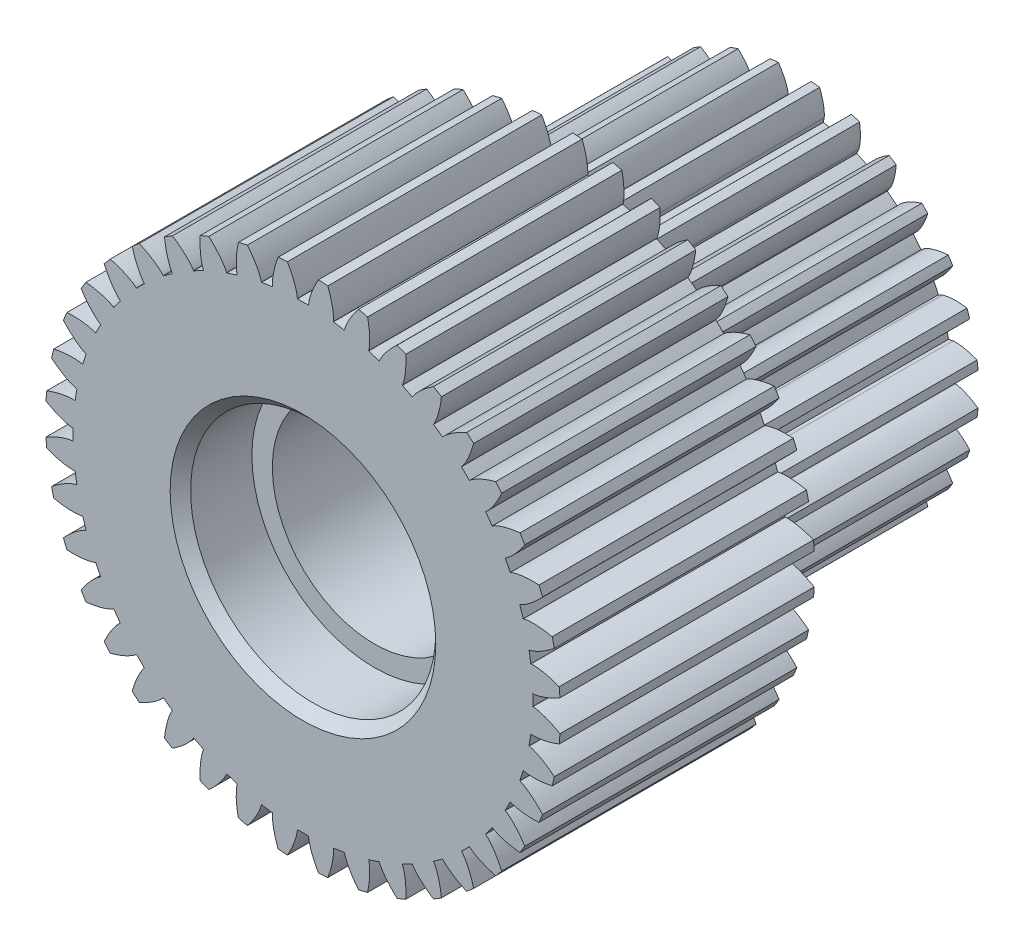
from build123d import *

# Parameters (mm, degrees)
SKETCH1_R           = 12.6
BOSS_EXTRUDE1_DEPTH = 6.222982735
CUT_EXTRUDE1_DEPTH  = 19.874467254
CIRPATTERN2_COUNT   = 40
SKETCH4_R           = 9
BOSS_EXTRUDE2_DEPTH = 11.62950298
CUT_EXTRUDE2_START  = -11.62950298
CUT_EXTRUDE2_DEPTH  = 11.62950298
CIRPATTERN3_COUNT   = 28
SKETCH3_R           = 5
CUT_EXTRUDE3_DEPTH  = 30.93309561
SKETCH7_R           = 6
CUT_EXTRUDE4_DEPTH  = 3.5
CHAMFER1_SIZE       = 0.5


with BuildPart() as part:
    # Sketch1 → Boss-Extrude1 (new, symmetric)
    with BuildSketch(Plane.XY):
        with Locations(Location((0, 0, 0), (0, 0, 180))):
            Circle(SKETCH1_R)
    extrude(amount=BOSS_EXTRUDE1_DEPTH, both=True)

    # Sketch2 → Cut-Extrude1 (cut, symmetric)
    with BuildSketch(Plane.XY):
        with BuildLine():
            Line((11.246660722, -0.274085027), (11.270510441, -0.274666253))
            add(Edge.make_bspline(
                [(11.270510441, -0.274666253), (11.274362796, -0.274815612), (11.285160796, -0.275406154), (11.305543882, -0.277200206), (11.338736538, -0.28108866), (11.3809122, -0.287453899), (11.435256469, -0.297297397), (11.499026137, -0.31096732), (11.568805837, -0.328156818), (11.644355714, -0.349188228), (11.719370108, -0.372223949), (11.793837153, -0.397107382), (11.867670292, -0.4236082), (11.95666212, -0.457724), (12.062733834, -0.501427934), (12.185699673, -0.556556039), (12.323897053, -0.623832925), (12.440159402, -0.685228824), (12.51999569, -0.729564843), (12.565479539, -0.755617713), (12.576923935, -0.762223288)],
                knots=[0, 0, 0, 0, 0, 0.005376749, 0.015083688, 0.02853182, 0.04661014, 0.064854849, 0.092110525, 0.119476176, 0.146842496, 0.174208854, 0.201574956, 0.228941013, 0.256307345, 0.307035032, 0.361767352, 0.416499661, 0.471231937, 0.489657345, 0.489657345, 0.489657345, 0.489657345, 0.489657345], degree=4))
            ThreePointArc((12.576923935, -0.762223288), (12.594229662, -0.381286259), (12.6, 0))
            ThreePointArc((12.6, 0), (12.594249502, 0.380630371), (12.577003257, 0.760913312))
            add(Edge.make_bspline(
                [(11.272964362, 0.274726056), (11.276816717, 0.274875415), (11.287614717, 0.275465957), (11.307997803, 0.277260009), (11.34119046, 0.281148463), (11.383366122, 0.287513702), (11.437710391, 0.2973572), (11.501480059, 0.311027123), (11.571259759, 0.328216621), (11.646809635, 0.349248031), (11.721824029, 0.372283752), (11.796291074, 0.397167184), (11.870124213, 0.423668003), (11.959116041, 0.457783803), (12.065187755, 0.501487737), (12.188153595, 0.556615842), (12.326350974, 0.623892728), (12.442004899, 0.68496733), (12.521256317, 0.72896209), (12.566150821, 0.754656839), (12.577003257, 0.760913312)],
                knots=[0, 0, 0, 0, 0, 0.005376749, 0.015083688, 0.02853182, 0.04661014, 0.064854849, 0.092110525, 0.119476176, 0.146842496, 0.174208854, 0.201574956, 0.228941013, 0.256307345, 0.307035032, 0.361767352, 0.416499661, 0.471231937, 0.488701644, 0.488701644, 0.488701644, 0.488701644, 0.488701644], degree=4))
            Line((11.272964362, 0.274726056), (11.246660722, 0.274085027))
            ThreePointArc((11.246660722, 0.274085027), (11.24916515, 0.137052684), (11.25, 0))
            ThreePointArc((11.25, 0), (11.24916515, -0.137052684), (11.246660722, -0.274085027))
        make_face()
    cut_extrude1 = extrude(amount=CUT_EXTRUDE1_DEPTH, both=True, mode=Mode.SUBTRACT)

    # CirPattern2: Cut-Extrude1 ×40 about axis
    cirpattern2_axis = Axis((0, 0, 6.222982735), (0, 0, -1))
    for i in range(1, CIRPATTERN2_COUNT):
        add(cut_extrude1.rotate(cirpattern2_axis, i * 360 / CIRPATTERN2_COUNT), mode=Mode.SUBTRACT)

    # Sketch4 → Boss-Extrude2 (add)
    with BuildSketch(Plane(origin=(0, 0, -6.222982735), x_dir=(-1, 0, 0), z_dir=(0, 0, -1))):
        with Locations(Location((0, 0, 0), (0, 0, 180))):
            Circle(SKETCH4_R)
    extrude(amount=BOSS_EXTRUDE2_DEPTH)

    # Sketch5 → Cut-Extrude2 (cut)
    with BuildSketch(Plane(origin=(0, 0, -17.852485715), x_dir=(-1, 0, 0), z_dir=(0, 0, -1)).offset(CUT_EXTRUDE2_START)):
        with BuildLine():
            add(Edge.make_bspline(
                [(7.864908633, 0.324182132), (7.867603141, 0.324332051), (7.875153713, 0.324872576), (7.898424632, 0.327316112), (7.944138999, 0.334311492), (8.000221168, 0.346060678), (8.064274923, 0.362529898), (8.125685364, 0.38074418), (8.177916633, 0.397750601), (8.229743045, 0.41604379), (8.281106732, 0.435461521), (8.342990291, 0.46038756), (8.416715125, 0.49222555), (8.50212959, 0.532258347), (8.598061506, 0.580973521), (8.694744064, 0.6341295), (8.788958417, 0.689306741), (8.868814402, 0.739411756), (8.923308451, 0.774953063), (8.955124139, 0.796315675), (8.964156804, 0.802429305)],
                knots=[0, 0, 0, 0, 0, 0.005376749, 0.015083688, 0.04661014, 0.092110525, 0.119476176, 0.146842496, 0.174208854, 0.201574956, 0.228941013, 0.256307345, 0.307035032, 0.361767352, 0.416499661, 0.471231937, 0.525964282, 0.580696616, 0.602381261, 0.602381261, 0.602381261, 0.602381261, 0.602381261], degree=4))
            Line((7.864908633, 0.324182132), (7.643509633, 0.31505633))
            ThreePointArc((7.643509633, 0.31505633), (7.648377236, 0.157561588), (7.65, 0))
            ThreePointArc((7.65, 0), (7.648377236, -0.157561588), (7.643509633, -0.31505633))
            Line((7.643509633, -0.31505633), (7.864908633, -0.324182132))
            add(Edge.make_bspline(
                [(7.864908633, -0.324182132), (7.867603141, -0.324332051), (7.875153713, -0.324872576), (7.898424632, -0.327316112), (7.944138999, -0.334311492), (8.000221168, -0.346060678), (8.064274923, -0.362529898), (8.125685364, -0.38074418), (8.177916633, -0.397750601), (8.229743045, -0.41604379), (8.281106732, -0.435461521), (8.342990291, -0.46038756), (8.416715125, -0.49222555), (8.50212959, -0.532258347), (8.598061506, -0.580973521), (8.694744064, -0.6341295), (8.788958417, -0.689306741), (8.868814402, -0.739411756), (8.923308451, -0.774953063), (8.955124139, -0.796315675), (8.964156804, -0.802429305)],
                knots=[0, 0, 0, 0, 0, 0.005376749, 0.015083688, 0.04661014, 0.092110525, 0.119476176, 0.146842496, 0.174208854, 0.201574956, 0.228941013, 0.256307345, 0.307035032, 0.361767352, 0.416499661, 0.471231937, 0.525964282, 0.580696616, 0.602381261, 0.602381261, 0.602381261, 0.602381261, 0.602381261], degree=4))
            ThreePointArc((8.964156804, -0.802429305), (8.991034736, -0.401614717), (9, 0))
            ThreePointArc((9, 0), (8.991034736, 0.401614717), (8.964156804, 0.802429305))
        make_face()
    cut_extrude2 = extrude(amount=CUT_EXTRUDE2_DEPTH, mode=Mode.SUBTRACT)

    # CirPattern3: Cut-Extrude2 ×28 about axis
    cirpattern3_axis = Axis((0, 0, -17.852485715), (0, 0, 1))
    for i in range(1, CIRPATTERN3_COUNT):
        add(cut_extrude2.rotate(cirpattern3_axis, i * 360 / CIRPATTERN3_COUNT), mode=Mode.SUBTRACT)

    # Sketch3 → Cut-Extrude3 (cut, through all)
    with BuildSketch(Plane.XY.offset(6.222982735)):
        Circle(SKETCH3_R)
    extrude(amount=-CUT_EXTRUDE3_DEPTH, mode=Mode.SUBTRACT)

    # Sketch7 → Cut-Extrude4 (cut)
    with BuildSketch(Plane(origin=(0, 0, -17.852485715), x_dir=(-1, 0, 0), z_dir=(0, 0, -1))):
        Circle(SKETCH7_R)
    cut_extrude4 = extrude(amount=-CUT_EXTRUDE4_DEPTH, mode=Mode.SUBTRACT)

    # Mirror1: Cut-Extrude4 across plane
    add(cut_extrude4.mirror(Plane(origin=(0, 0, -5.81475149), x_dir=(1, 0, 0), z_dir=(0, 0, -1))), mode=Mode.SUBTRACT)

    # Chamfer1
    chamfer1_edges = [part.edges().sort_by_distance(p)[0] for p in [
        (6, 0, -17.852485715),
        (6, 0, 6.222982735),
    ]]
    chamfer(chamfer1_edges, length=CHAMFER1_SIZE)


solid = part.part
